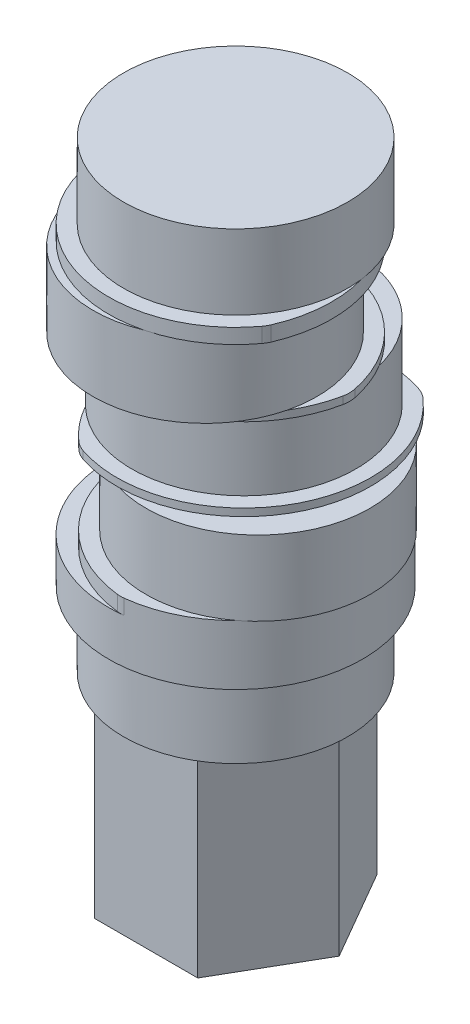
from build123d import *

# Parameters (mm, degrees)
BOSS_EXTRUDE1_DEPTH  = 13
SKETCH5_R            = 7.5
BOSS_EXTRUDE2_DEPTH  = 8
BOSS_EXTRUDE3_DEPTH  = 1
SKETCH7_R            = 7.5
BOSS_EXTRUDE4_DEPTH  = 5
BOSS_EXTRUDE5_DEPTH  = 0.5
SKETCH9_R            = 7.5
BOSS_EXTRUDE6_DEPTH  = 5
BOSS_EXTRUDE7_DEPTH  = 0.5
SKETCH12_R           = 7.5
BOSS_EXTRUDE8_DEPTH  = 5
BOSS_EXTRUDE9_DEPTH  = 1
SKETCH14_R           = 7.5
BOSS_EXTRUDE10_DEPTH = 5
FILLET1_R            = 2
BOSS_EXTRUDE11_START = 3
SKETCH15_R           = 8.5
BOSS_EXTRUDE11_DEPTH = 3


with BuildPart() as part:
    # Sketch4 → Boss-Extrude1 (new body)
    with BuildSketch(Plane(origin=(0, 0, 0), x_dir=(1, 0, 0), z_dir=(0, 1, 0))):
        Polygon((-3.464101615, 6), (-6.92820323, 0), (-3.464101615, -6), (3.464101615, -6), (6.92820323, 0), (3.464101615, 6), align=None)
    extrude(amount=BOSS_EXTRUDE1_DEPTH)

    # Sketch5 → Boss-Extrude2 (add)
    with BuildSketch(Plane(origin=(0, 13, 0), x_dir=(1, 0, 0), z_dir=(0, 1, 0))):
        Circle(SKETCH5_R)
    extrude(amount=BOSS_EXTRUDE2_DEPTH)

    # Sketch6 → Boss-Extrude3 (add)
    with BuildSketch(Plane(origin=(0, 21, 0), x_dir=(1, 0, 0), z_dir=(0, 1, 0))):
        with BuildLine():
            ThreePointArc((0.75, -8.466847111), (8.5, 0), (0.75, 8.466847111))
            ThreePointArc((0.75, 8.466847111), (-7, 0), (0.75, -8.466847111))
        make_face()
    extrude(amount=BOSS_EXTRUDE3_DEPTH)

    # Sketch7 → Boss-Extrude4 (add)
    with BuildSketch(Plane(origin=(0, 22, 0), x_dir=(1, 0, 0), z_dir=(0, 1, 0))):
        with Locations((1.5, 0)):
            Circle(SKETCH7_R)
    extrude(amount=BOSS_EXTRUDE4_DEPTH)

    # Sketch8 → Boss-Extrude5 (add)
    with BuildSketch(Plane(origin=(0, 27, 0), x_dir=(1, 0, 0), z_dir=(0, 1, 0))):
        with BuildLine():
            ThreePointArc((4.575074404, 7.924261316), (-5.861215932, 4.25), (-3.825074404, -6.625223211))
            ThreePointArc((-3.825074404, -6.625223211), (6.611215932, -2.950961894), (4.575074404, 7.924261316))
        make_face()
    extrude(amount=BOSS_EXTRUDE5_DEPTH)

    # Sketch9 → Boss-Extrude6 (add)
    with BuildSketch(Plane(origin=(0, 27.5, 0), x_dir=(1, 0, 0), z_dir=(0, 1, 0))):
        with Locations((-0.75, 1.299038106)):
            Circle(SKETCH9_R)
    extrude(amount=BOSS_EXTRUDE6_DEPTH)

    # Sketch11 → Boss-Extrude7 (add)
    with BuildSketch(Plane(origin=(0, 32.5, 0), x_dir=(1, 0, 0), z_dir=(0, 1, 0))):
        with BuildLine():
            ThreePointArc((-9.150148808, 0), (-0.75, -7.200961894), (7.650148808, 0))
            ThreePointArc((7.650148808, 0), (-0.75, 7.200961894), (-9.150148808, 0))
        make_face()
    extrude(amount=BOSS_EXTRUDE7_DEPTH)

    # Sketch12 → Boss-Extrude8 (add)
    with BuildSketch(Plane(origin=(0, 33, 0), x_dir=(1, 0, 0), z_dir=(0, 1, 0))):
        with Locations((-0.75, -1.299038106)):
            Circle(SKETCH12_R)
    extrude(amount=BOSS_EXTRUDE8_DEPTH)

    # Sketch13 → Boss-Extrude9 (add)
    with BuildSketch(Plane(origin=(0, 38, 0), x_dir=(1, 0, 0), z_dir=(0, 1, 0))):
        with BuildLine():
            ThreePointArc((6.957504688, -4.882942608), (3.5, 6.062177826), (-7.707504688, 3.583904503))
            ThreePointArc((-7.707504688, 3.583904503), (-4.25, -7.361215932), (6.957504688, -4.882942608))
        make_face()
    extrude(amount=BOSS_EXTRUDE9_DEPTH)

    # Sketch14 → Boss-Extrude10 (add)
    with BuildSketch(Plane(origin=(0, 39, 0), x_dir=(1, 0, 0), z_dir=(0, 1, 0))):
        Circle(SKETCH14_R)
    extrude(amount=BOSS_EXTRUDE10_DEPTH)

    # Fillet1
    fillet1_edges = [part.edges().sort_by_distance(p)[0] for p in [
        (0.75, 21.5, -8.466847111),
        (0.75, 21.5, 8.466847111),
        (-3.825074404, 27.25, 6.625223211),
        (4.575074404, 27.25, -7.924261316),
        (7.650148808, 32.75, 0),
        (-9.150148808, 32.75, 0),
        (-7.707504688, 38.5, -3.583904503),
        (6.957504688, 38.5, 4.882942608),
    ]]
    fillet(fillet1_edges, radius=FILLET1_R)

    # Sketch15 → Boss-Extrude11 (add)
    with BuildSketch(Plane.XZ.offset(-21).offset(BOSS_EXTRUDE11_START)):
        Circle(SKETCH15_R)
    extrude(amount=-BOSS_EXTRUDE11_DEPTH)


solid = part.part
